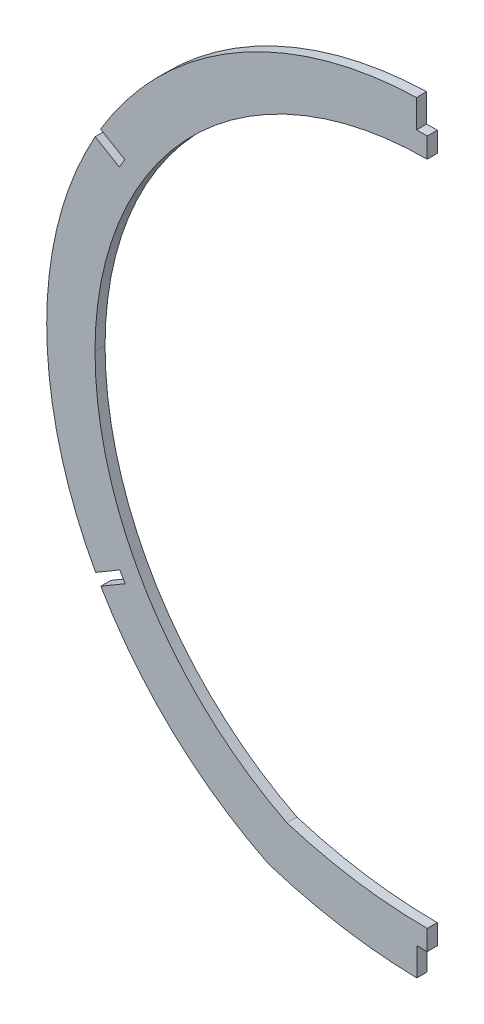
from build123d import *

# Parameters (mm, degrees)
BOSS_EXTRUDE1_DEPTH = 1.5875
SKETCH3_W           = 208.645691316
SKETCH3_H           = 383.026987577
CUT_EXTRUDE1_DEPTH  = 184.927178997
CUT_EXTRUDE2_DEPTH  = 184.877950547


with BuildPart() as part:
    # Sketch2 → Boss-Extrude1 (new, symmetric)
    with BuildSketch(Plane.XY):
        with BuildLine():
            ThreePointArc((-120.098895727, 19.05), (0.406748907, 139.2017743), (120.203613722, 18.343301545))
            ThreePointArc((120.203613722, 18.343301545), (101.067699546, -47.629728931), (50.138751442, -93.726))
            ThreePointArc((50.138751442, -93.726), (0.040174098, -101.514794876), (-50.058403246, -93.726))
            ThreePointArc((-50.058403246, -93.726), (-101.163912713, -47.327889321), (-120.098895727, 19.05))
        make_face()
        with BuildLine():
            ThreePointArc((-104.858895727, 19.05), (0.361930242, 123.961840203), (104.963877332, 18.432938489))
            ThreePointArc((104.963877332, 18.432938489), (88.446745877, -39.065849025), (44.40486057, -79.553359885))
            ThreePointArc((44.40486057, -79.553359885), (0.040463589, -86.274794876), (-44.323959374, -79.553531384))
            ThreePointArc((-44.323959374, -79.553531384), (-88.517658334, -38.801393502), (-104.858895727, 19.05))
        make_face(mode=Mode.SUBTRACT)
    extrude(amount=BOSS_EXTRUDE1_DEPTH, both=True)

    # Sketch3 → Cut-Extrude1 (cut, through all)
    with BuildSketch(Plane(origin=(0, 0, 0), x_dir=(0, 0, -1), z_dir=(1, 0, 0))):
        with Locations((4.266053154, 20.866300598)):
            Rectangle(SKETCH3_W, SKETCH3_H)
    extrude(amount=CUT_EXTRUDE1_DEPTH, mode=Mode.SUBTRACT)

    # Sketch4 → Cut-Extrude2 (cut, through all)
    with BuildSketch(Plane.XY.offset(1.5875)):
        with BuildLine():
            Line((-3.3782, 139.153279965), (-3.3782, 130.312293878))
            Line((-3.3782, 130.312293878), (0, 130.312293878))
            Line((0, 130.312293878), (0, 139.202282013))
            ThreePointArc((0, 139.202282013), (-1.689272244, 139.189655502), (-3.3782, 139.153279965))
        make_face()
        with BuildLine():
            Line((-3.302, -92.624794876), (-3.302, -101.48094955))
            ThreePointArc((-3.302, -101.48094955), (-1.651084663, -101.506132106), (0, -101.514794876))
            Line((0, -101.514794876), (0, -92.624794876))
            Line((0, -92.624794876), (-3.302, -92.624794876))
        make_face()
        with BuildLine():
            Line((-97.044954451, -36.819436689), (-104.679734985, -41.300066711))
            ThreePointArc((-104.679734985, -41.300066711), (-103.859441192, -42.776931517), (-103.019390964, -44.242648808))
            Line((-103.019390964, -44.242648808), (-95.335093375, -39.732958671))
            Line((-95.335093375, -39.732958671), (-97.044954451, -36.819436689))
        make_face()
        with BuildLine():
            Line((-95.442778735, 76.146002016), (-103.1094988, 80.645376586))
            ThreePointArc((-103.1094988, 80.645376586), (-103.96522962, 79.188995674), (-104.80040165, 77.720728574))
            Line((-104.80040165, 77.720728574), (-97.152639859, 73.232480062))
            Line((-97.152639859, 73.232480062), (-95.442778735, 76.146002016))
        make_face()
    extrude(amount=-CUT_EXTRUDE2_DEPTH, mode=Mode.SUBTRACT)


solid = part.part
